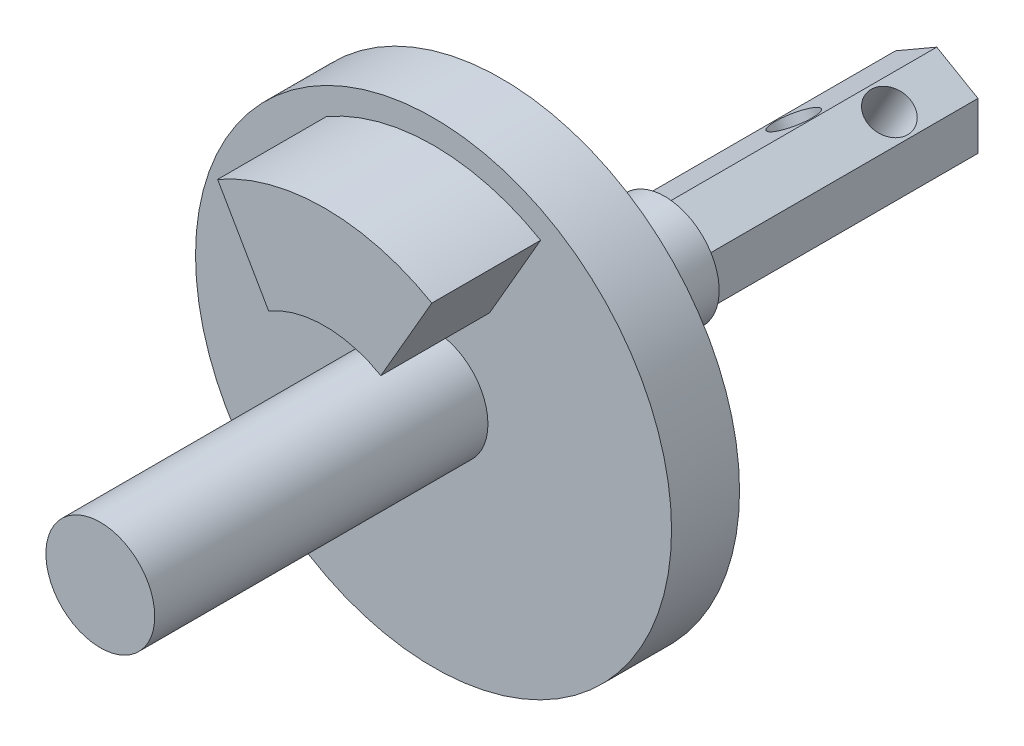
from build123d import *

# Parameters (mm, degrees)
SKETCH1_R           = 17.5
BOSS_EXTRUDE1_DEPTH = 2.5
BOSS_EXTRUDE2_DEPTH = 8
SKETCH3_R           = 4
BOSS_EXTRUDE3_DEPTH = 24.5
BOSS_EXTRUDE4_START = 12
SKETCH7_R           = 4
BOSS_EXTRUDE4_DEPTH = 12
BOSS_EXTRUDE5_DEPTH = 20
SKETCH10_R          = 1.55
CUT_EXTRUDE1_DEPTH  = 6.1
SKETCH11_R          = 1.55
CUT_EXTRUDE4_DEPTH  = 6.1


with BuildPart() as part:
    # Sketch1 → Boss-Extrude1 (new, symmetric)
    with BuildSketch(Plane.XY):
        Circle(SKETCH1_R)
    extrude(amount=BOSS_EXTRUDE1_DEPTH, both=True)

    # Sketch2 → Boss-Extrude2 (add)
    with BuildSketch(Plane.XY.offset(2.5)):
        with BuildLine():
            Line((7.875, 13.63990011), (4.125, 7.144709581))
            ThreePointArc((4.125, 7.144709581), (0, 8.25), (-4.125, 7.144709581))
            Line((-4.125, 7.144709581), (-7.875, 13.63990011))
            ThreePointArc((-7.875, 13.63990011), (0, 15.75), (7.875, 13.63990011))
        make_face()
    extrude(amount=BOSS_EXTRUDE2_DEPTH)

    # Sketch3 → Boss-Extrude3 (add)
    with BuildSketch(Plane.XY.offset(2.5)):
        Circle(SKETCH3_R)
    extrude(amount=BOSS_EXTRUDE3_DEPTH)

    # Sketch7 → Boss-Extrude4 (add)
    with BuildSketch(Plane(origin=(0, 0, -2.5), x_dir=(-1, 0, 0), z_dir=(0, 0, -1)).offset(BOSS_EXTRUDE4_START)):
        Circle(SKETCH7_R)
    extrude(amount=-BOSS_EXTRUDE4_DEPTH)

    # Sketch9 → Boss-Extrude5 (add)
    with BuildSketch(Plane(origin=(0, 0, -14.5), x_dir=(-1, 0, 0), z_dir=(0, 0, -1))):
        Polygon((0, 3.5), (-3.031088913, 1.75), (-3.031088913, -1.75), (0, -3.5), (3.031088913, -1.75), (3.031088913, 1.75), align=None)
    extrude(amount=BOSS_EXTRUDE5_DEPTH)

    # Sketch10 → Cut-Extrude1 (cut)
    with BuildSketch(Plane(origin=(-1.515544457, -2.625, 0), x_dir=(0.866025403784435, -0.5000000000000062, 0), z_dir=(-0.5000000000000062, -0.866025403784435, 0))):
        with Locations((0, -29.5)):
            Circle(SKETCH10_R)
    extrude(amount=-CUT_EXTRUDE1_DEPTH, mode=Mode.SUBTRACT)

    # Sketch11 → Cut-Extrude4 (cut)
    with BuildSketch(Plane(origin=(1.515544457, -2.625, 0), x_dir=(0, 0, 1), z_dir=(-0.49999999999999717, 0.8660254037844404, 0))):
        with Locations((-25.5, 0)):
            Circle(SKETCH11_R)
    extrude(amount=CUT_EXTRUDE4_DEPTH, mode=Mode.SUBTRACT)


solid = part.part
